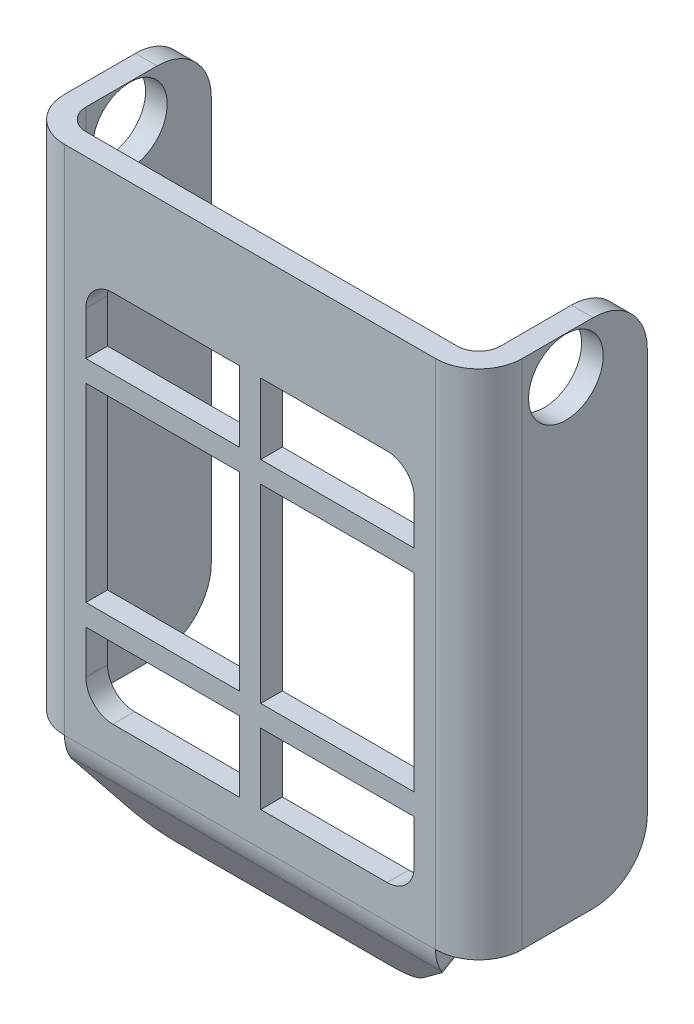
from build123d import *

# Parameters (mm, degrees)
SKETCH1_W                      = 20.955
SKETCH1_H                      = 20.701
BOSS_EXTRUDE1_DEPTH            = 7.62
FILLET3_R                      = 0.762
SHELL1_T                       = -1.016
SKETCH3_W                      = 18.923
SKETCH3_H                      = 1.016
CUT_EXTRUDE1_DEPTH             = 6.604
CONVERT_SOLID1_START           = -10.4775
CONVERT_SOLID1_OUTLINE_W       = 20.701
CONVERT_SOLID1_OUTLINE_H       = 6.604
CONVERT_SOLID1_DEPTH           = 20.955
CONVERT_SOLID1_2_OUTLINE_W     = 20.701
CONVERT_SOLID1_2_OUTLINE_H     = 1.016
CONVERT_SOLID1_2_DEPTH         = 0.762
CONVERT_SOLID1_START_2         = 9.7155
CONVERT_SOLID1_3_OUTLINE_W     = 20.701
CONVERT_SOLID1_3_OUTLINE_H     = 1.016
CONVERT_SOLID1_3_DEPTH         = 0.762
EDGE_FLANGE1_STRIP_W           = 6.096
EDGE_FLANGE1_STRIP_H           = 1.016
EDGE_FLANGE1_STRIP_CUT_DEPTH   = 20.701
EDGE_FLANGE1_STRIP_2_W         = 6.096
EDGE_FLANGE1_STRIP_2_H         = 1.016
EDGE_FLANGE1_STRIP_CUT_2_DEPTH = 20.701
EDGE_FLANGE1_DEPTH             = 20.701
EDGE_FLANGE1_BEND_DEPTH        = 20.701
EDGE_FLANGE2_DEPTH             = 17.399
CHAMFER1_SIZE                  = 2.54
SKETCH23_W                     = 15.399
SKETCH23_H                     = 17.526
CUT_EXTRUDE2_DEPTH             = 20.071990326
FILLET5_R                      = 1.27
SKETCH24_W                     = 1
SKETCH24_H                     = 17.526
SKETCH24_W_2                   = 15.399
SKETCH24_H_2                   = 1
EXTRUDE_THIN1_DEPTH            = 1.016
BOSS_EXTRUDE2_DEPTH            = 3.302
FILLET4_R                      = 2.54
F_3_5_3_5_DIAMETER_HOLE1_D     = 3.5
FILLET6_R                      = 2.54


with BuildPart() as part:
    # Sketch1 → Boss-Extrude1 (new body)
    with BuildSketch(Plane.XY):
        Rectangle(SKETCH1_W, SKETCH1_H)
    extrude(amount=BOSS_EXTRUDE1_DEPTH)

    # Fillet3
    fillet3_edges = [part.edges().sort_by_distance(p)[0] for p in [
        (10.4775, 0, 7.62),
        (-10.4775, 0, 7.62),
    ]]
    fillet(fillet3_edges, radius=FILLET3_R)

    # Shell1
    shell1_openings = [part.faces().sort_by_distance(p)[0] for p in [
        (0, 0, 0),
    ]]
    offset(amount=SHELL1_T, openings=shell1_openings, kind=Kind.INTERSECTION)

    # Sketch3 → Cut-Extrude1 (cut)
    with BuildSketch(Plane(origin=(0, 0, 0), x_dir=(-1, 0, 0), z_dir=(0, 0, -1))):
        with Locations((0, -9.8425)):
            Rectangle(SKETCH3_W, SKETCH3_H)
    extrude(amount=-CUT_EXTRUDE1_DEPTH, mode=Mode.SUBTRACT)

    # Convert-Solid1: read off the stored shape, not the designer's step
    # Convert-Solid1 outline → Convert-Solid1 (cut)
    with BuildSketch(Plane.YZ.offset(CONVERT_SOLID1_START)):
        with Locations((0, 3.302)):
            Rectangle(CONVERT_SOLID1_OUTLINE_W, CONVERT_SOLID1_OUTLINE_H)
    extrude(amount=CONVERT_SOLID1_DEPTH, mode=Mode.SUBTRACT)

    # Convert-Solid1 2 outline → Convert-Solid1 2 (cut)
    with BuildSketch(Plane.YZ.offset(CONVERT_SOLID1_START)):
        with Locations((0, 7.112)):
            Rectangle(CONVERT_SOLID1_2_OUTLINE_W, CONVERT_SOLID1_2_OUTLINE_H)
    extrude(amount=CONVERT_SOLID1_2_DEPTH, mode=Mode.SUBTRACT)

    # Convert-Solid1 3 outline → Convert-Solid1 3 (cut)
    with BuildSketch(Plane.YZ.offset(CONVERT_SOLID1_START_2)):
        with Locations((0, 7.112)):
            Rectangle(CONVERT_SOLID1_3_OUTLINE_W, CONVERT_SOLID1_3_OUTLINE_H)
    extrude(amount=CONVERT_SOLID1_3_DEPTH, mode=Mode.SUBTRACT)

    # Edge-Flange1: sheet metal written as solids
    # Edge-Flange1 strip (on a plane across the edge) → Edge-Flange1 strip cut (cut)
    with BuildSketch(Plane(origin=(9.7155, 10.3505, 6.604), x_dir=(-1, 0, 0), z_dir=(0, -1, 0))):
        with Locations((-2.032, -0.508)):
            Rectangle(EDGE_FLANGE1_STRIP_W, EDGE_FLANGE1_STRIP_H)
    extrude(amount=EDGE_FLANGE1_STRIP_CUT_DEPTH, mode=Mode.SUBTRACT)

    # Edge-Flange1 strip 2 (on a plane across the edge) → Edge-Flange1 strip cut 2 (cut)
    with BuildSketch(Plane(origin=(-9.7155, -10.3505, 6.604), x_dir=(1, 0, 0), z_dir=(0, 1, 0))):
        with Locations((-2.032, -0.508)):
            Rectangle(EDGE_FLANGE1_STRIP_2_W, EDGE_FLANGE1_STRIP_2_H)
    extrude(amount=EDGE_FLANGE1_STRIP_CUT_2_DEPTH, mode=Mode.SUBTRACT)

    # Edge-Flange1 section (on a plane across the edge) → Edge-Flange1 (add)
    with BuildSketch(Plane(origin=(9.7155, 10.3505, 6.604), x_dir=(-1, 0, 0), z_dir=(0, -1, 0))):
        with BuildLine():
            Line((-1.016, 1.016), (-1.016, 6.8834))
            Line((-1.016, 6.8834), (0, 6.8834))
            Line((0, 6.8834), (0, 1.016))
            ThreePointArc((0, 1.016), (0.29757951, 0.29757951), (1.016, 0))
            Line((1.016, 0), (1.016, -1.016))
            ThreePointArc((1.016, -1.016), (-0.420840979, -0.420840979), (-1.016, 1.016))
        make_face()
    extrude(amount=EDGE_FLANGE1_DEPTH)

    # Edge-Flange1 section 2 (on a plane across the edge) → Edge-Flange1 bend (add)
    with BuildSketch(Plane(origin=(-9.7155, -10.3505, 6.604), x_dir=(1, 0, 0), z_dir=(0, 1, 0))):
        with BuildLine():
            Line((-1.016, 1.016), (-1.016, 6.8834))
            Line((-1.016, 6.8834), (0, 6.8834))
            Line((0, 6.8834), (0, 1.016))
            ThreePointArc((0, 1.016), (0.29757951, 0.29757951), (1.016, 0))
            Line((1.016, 0), (1.016, -1.016))
            ThreePointArc((1.016, -1.016), (-0.420840979, -0.420840979), (-1.016, 1.016))
        make_face()
    extrude(amount=EDGE_FLANGE1_BEND_DEPTH)

    # Edge-Flange2: sheet metal written as solids
    # Edge-Flange2 section (on a plane across the edge) → Edge-Flange2 (add)
    with BuildSketch(Plane(origin=(8.6995, -10.62273638, 6.604), x_dir=(0, 0.49999999999999495, -0.8660254037844416), z_dir=(-1, 0, 0))):
        with BuildLine():
            Line((-1.016, 0.27223638), (-1.016, 2.90276362))
            Line((-1.016, 2.90276362), (0, 2.90276362))
            Line((0, 2.90276362), (0, 0.27223638))
            ThreePointArc((0, 0.27223638), (0.03461936, 0.00927623), (0.13611819, -0.23576362))
            Line((0.13611819, -0.23576362), (-0.74376362, -0.74376362))
            ThreePointArc((-0.74376362, -0.74376362), (-0.946761279, -0.25368392), (-1.016, 0.27223638))
        make_face()
    extrude(amount=EDGE_FLANGE2_DEPTH)

    # Chamfer1
    chamfer1_edges = [part.edges().sort_by_distance(p)[0] for p in [
        (8.6995, -13.390603416, 5.592559095),
        (-8.6995, -13.390603416, 5.592559095),
    ]]
    chamfer(chamfer1_edges, length=CHAMFER1_SIZE)

    # Sketch23 → Cut-Extrude2 (cut, through all)
    with BuildSketch(Plane.XY.offset(7.62)):
        Rectangle(SKETCH23_W, SKETCH23_H)
    extrude(amount=-CUT_EXTRUDE2_DEPTH, mode=Mode.SUBTRACT)

    # Fillet5
    fillet5_edges = [part.edges().sort_by_distance(p)[0] for p in [
        (-7.6995, 8.763, 7.112),
        (7.6995, 8.763, 7.112),
        (7.6995, -8.763, 7.112),
        (-7.6995, -8.763, 7.112),
    ]]
    fillet(fillet5_edges, radius=FILLET5_R)

    # Sketch24 → Extrude-Thin1 (add)
    with BuildSketch(Plane.XY.offset(7.62)):
        Rectangle(SKETCH24_W, SKETCH24_H)
        with Locations((0, -4.953)):
            Rectangle(SKETCH24_W_2, SKETCH24_H_2)
        with Locations((0, 4.953)):
            Rectangle(SKETCH24_W_2, SKETCH24_H_2)
    extrude(amount=-EXTRUDE_THIN1_DEPTH)

    # Sketch25 → Boss-Extrude2 (add)
    with BuildSketch(Plane(origin=(0, 10.3505, 0), x_dir=(1, 0, 0), z_dir=(0, 1, 0))):
        with BuildLine():
            Line((10.7315, -5.588), (10.7315, 0.2794))
            Line((10.7315, 0.2794), (9.7155, 0.2794))
            Line((9.7155, 0.2794), (9.7155, -5.588))
            ThreePointArc((9.7155, -5.588), (9.41792049, -6.30642049), (8.6995, -6.604))
            Line((8.6995, -6.604), (-8.6995, -6.604))
            ThreePointArc((-8.6995, -6.604), (-9.41792049, -6.30642049), (-9.7155, -5.588))
            Line((-9.7155, -5.588), (-9.7155, 0.2794))
            Line((-9.7155, 0.2794), (-10.7315, 0.2794))
            Line((-10.7315, 0.2794), (-10.7315, -5.588))
            ThreePointArc((-10.7315, -5.588), (-10.136340979, -7.024840979), (-8.6995, -7.62))
            Line((-8.6995, -7.62), (8.6995, -7.62))
            ThreePointArc((8.6995, -7.62), (10.136340979, -7.024840979), (10.7315, -5.588))
        make_face()
    extrude(amount=BOSS_EXTRUDE2_DEPTH)

    # Fillet4
    fillet4_edges = [part.edges().sort_by_distance(p)[0] for p in [
        (10.2235, 13.6525, -0.2794),
        (-10.2235, 13.6525, -0.2794),
        (10.2235, -10.3505, -0.2794),
        (-10.2235, -10.3505, -0.2794),
    ]]
    fillet(fillet4_edges, radius=FILLET4_R)

    # Ø3.5 (3.5) Diameter Hole1 (through all)
    with Locations(Plane(origin=(10.7315, 0, 0), x_dir=(0, 0, -1), z_dir=(1, 0, 0))):
        with Locations((-3.5386, 11.8745)):
            Hole(F_3_5_3_5_DIAMETER_HOLE1_D / 2)

    # Fillet6
    fillet6_edges = [part.edges().sort_by_distance(p)[0] for p in [
        (-6.1595, -13.390603416, 5.592559095),
        (6.1595, -13.390603416, 5.592559095),
    ]]
    fillet(fillet6_edges, radius=FILLET6_R)


solid = part.part
